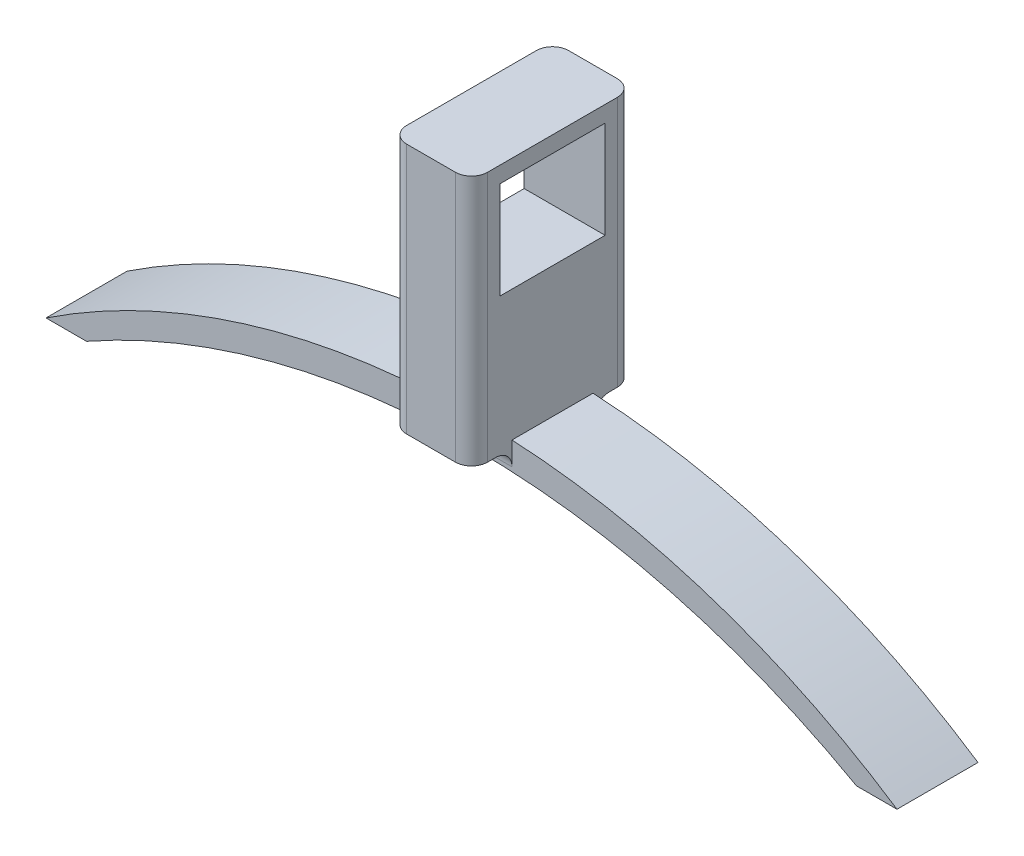
from build123d import *

# Parameters (mm, degrees)
BOSS_EXTRUDE1_DEPTH = 10
SCALE1_SCALE        = 0.5
SKETCH4_W           = 5
SKETCH4_H           = 10
BOSS_EXTRUDE4_DEPTH = 15
SKETCH5_W           = 5
SKETCH5_H           = 10
BOSS_EXTRUDE5_DEPTH = 0.5
FILLET1_R           = 1
SKETCH6_W           = 6.5
SKETCH6_H           = 6
CUT_EXTRUDE1_DEPTH  = 42.224425768


with BuildPart() as part:
    # Sketch1 → Boss-Extrude1 (new body)
    with BuildSketch(Plane.XY):
        with BuildLine():
            Line((0, 0), (5, 0))
            ThreePointArc((5, 0), (52.528561354, 12.453541306), (100.057122708, 0))
            Line((100.057122708, 0), (105.057122708, 0))
            ThreePointArc((105.057122708, 0), (52.528561354, 15.847728612), (0, 0))
        make_face()
    extrude(amount=BOSS_EXTRUDE1_DEPTH)


with BuildPart() as part_1:
    # Scale1: scaled about (52.528561354, 9.724546383, 5)
    add(part.part.scale(SCALE1_SCALE).moved(Location((26.264280677, 4.862273191, 2.5))))



with BuildPart() as body_2:
    # Sketch4 → Boss-Extrude4 (new body)
    with BuildSketch(Plane(origin=(0, 12.786137497, 0), x_dir=(1, 0, 0), z_dir=(0, 1, 0))):
        with Locations((52.528561354, -5)):
            Rectangle(SKETCH4_W, SKETCH4_H)
    extrude(amount=BOSS_EXTRUDE4_DEPTH)


with BuildPart() as part_2:
    add(part_1.part)

    add(body_2.part)  # Boss-Extrude5 merges body 2
    # Sketch5 → Boss-Extrude5 (add)
    with BuildSketch(Plane.XZ.offset(-12.786137497)):
        with Locations((52.528561354, 5)):
            Rectangle(SKETCH5_W, SKETCH5_H)
    extrude(amount=BOSS_EXTRUDE5_DEPTH)

    # Fillet1
    fillet1_edges = [part_2.edges().sort_by_distance(p)[0] for p in [
        (52.528561354, 12.286137497, 2.5),
        (52.528561354, 12.286137497, 7.5),
        (50.028561354, 20.036137497, 0),
        (55.028561354, 20.036137497, 0),
        (55.028561354, 20.036137497, 10),
        (50.028561354, 20.036137497, 10),
    ]]
    fillet(fillet1_edges, radius=FILLET1_R)

    # Sketch6 → Cut-Extrude1 (cut, through all)
    with BuildSketch(Plane(origin=(55.028561354, 0, 0), x_dir=(0, 0, -1), z_dir=(1, 0, 0))):
        with Locations((-5, 23.786137497)):
            Rectangle(SKETCH6_W, SKETCH6_H)
    extrude(amount=-CUT_EXTRUDE1_DEPTH, mode=Mode.SUBTRACT)


solid = part_2.part
